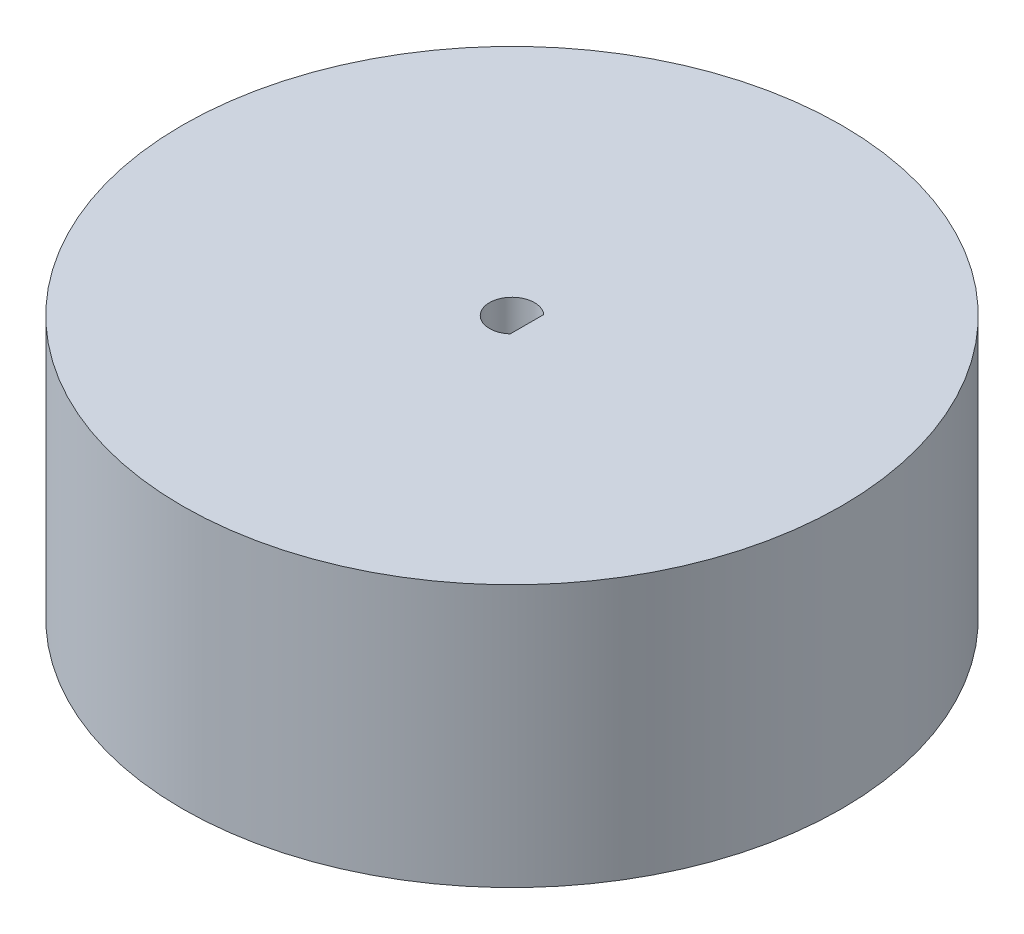
from build123d import *

# Parameters (mm, degrees)
SKETCH1_R           = 22
BOSS_EXTRUDE1_DEPTH = 17.5
CUT_EXTRUDE1_REACH  = 37.697
SKETCH3_R           = 12
CUT_EXTRUDE2_DEPTH  = 13


with BuildPart() as part:
    # Sketch1 → Boss-Extrude1 (new body)
    with BuildSketch(Plane(origin=(0, 0, 0), x_dir=(1, 0, 0), z_dir=(0, 1, 0))):
        Circle(SKETCH1_R)
    extrude(amount=BOSS_EXTRUDE1_DEPTH)

    # Sketch2 → Cut-Extrude1 (cut, up to next)
    with BuildSketch(Plane(origin=(0, 17.5, 0), x_dir=(1, 0, 0), z_dir=(0, 1, 0)), mode=Mode.PRIVATE) as cut_extrude1_sk1:
        with BuildLine():
            Line((1, 1.118033989), (1, -1.118033989))
            ThreePointArc((1, -1.118033989), (-1.5, 0), (1, 1.118033989))
        make_face()
    cut_extrude1_tool1 = extrude(cut_extrude1_sk1.sketch, amount=-CUT_EXTRUDE1_REACH, mode=Mode.PRIVATE) & part.part
    add(cut_extrude1_tool1.solids().sort_by_distance((-0.148024, 17.5, 0))[0], mode=Mode.SUBTRACT)

    # Sketch3 → Cut-Extrude2 (cut)
    with BuildSketch(Plane.XZ):
        Circle(SKETCH3_R)
    extrude(amount=-CUT_EXTRUDE2_DEPTH, mode=Mode.SUBTRACT)


solid = part.part
